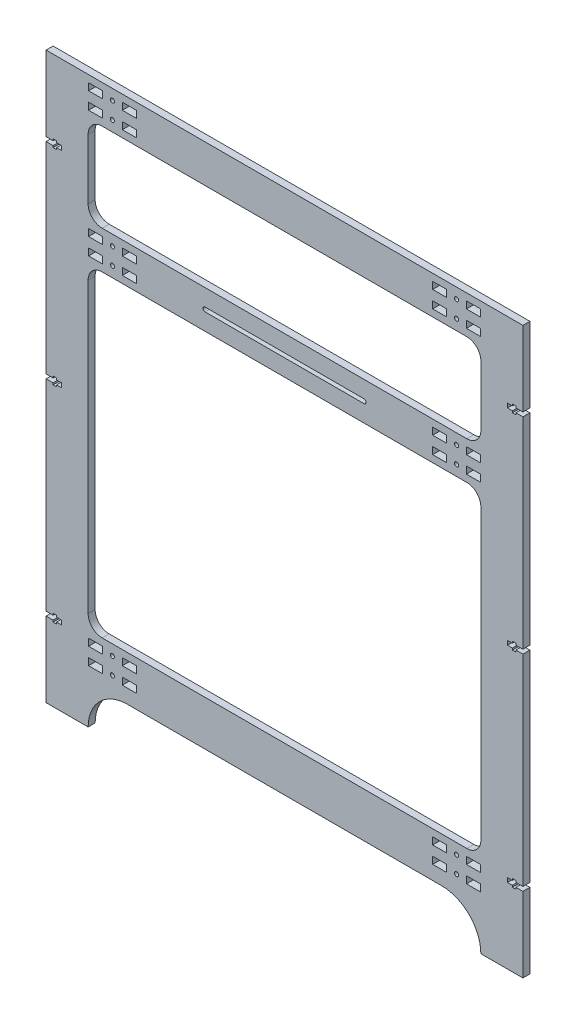
from build123d import *

# Parameters (mm, degrees)
SKETCH1_SIDE_SKETCH_2_W = 10
SKETCH1_SIDE_SKETCH_2_H = 5
SKETCH1_SIDE_SKETCH_2_R = 1.5
BOSS_EXTRUDE1_DEPTH     = 5


with BuildPart() as part:
    # Sketch1-Side Sketch<2> → Boss-Extrude1 (new body)
    with BuildSketch(Plane.XY):
        with BuildLine():
            Line((170, 100), (-170, 100))
            Line((-170, 100), (-170, 90))
            Line((-170, 90), (-170, 70))
            Line((-170, 70), (-170, 60))
            Line((-170, 60), (-170, 46.5))
            Line((-170, 46.5), (-165, 46.5))
            Line((-165, 46.5), (-165, 47.75))
            Line((-165, 47.75), (-162.5, 47.75))
            Line((-162.5, 47.75), (-162.5, 46.5))
            Line((-162.5, 46.5), (-159, 46.5))
            Line((-159, 46.5), (-159, 43.5))
            Line((-159, 43.5), (-162.5, 43.5))
            Line((-162.5, 43.5), (-162.5, 42.25))
            Line((-162.5, 42.25), (-165, 42.25))
            Line((-165, 42.25), (-165, 43.5))
            Line((-165, 43.5), (-170, 43.5))
            Line((-170, 43.5), (-170, 30))
            Line((-170, 30), (-170, 20))
            Line((-170, 20), (-170, -76.5))
            Line((-170, -76.5), (-170, -86.5))
            Line((-170, -86.5), (-170, -100))
            Line((-170, -100), (-165, -100))
            Line((-165, -100), (-165, -98.75))
            Line((-165, -98.75), (-162.5, -98.75))
            Line((-162.5, -98.75), (-162.5, -100))
            Line((-162.5, -100), (-159, -100))
            Line((-159, -100), (-159, -103))
            Line((-159, -103), (-162.5, -103))
            Line((-162.5, -103), (-162.5, -104.25))
            Line((-162.5, -104.25), (-165, -104.25))
            Line((-165, -104.25), (-165, -103))
            Line((-165, -103), (-170, -103))
            Line((-170, -103), (-170, -116.5))
            Line((-170, -116.5), (-170, -126.5))
            Line((-170, -126.5), (-170, -223))
            Line((-170, -223), (-170, -233))
            Line((-170, -233), (-170, -246.5))
            Line((-170, -246.5), (-165, -246.5))
            Line((-165, -246.5), (-165, -245.25))
            Line((-165, -245.25), (-162.5, -245.25))
            Line((-162.5, -245.25), (-162.5, -246.5))
            Line((-162.5, -246.5), (-159, -246.5))
            Line((-159, -246.5), (-159, -249.5))
            Line((-159, -249.5), (-162.5, -249.5))
            Line((-162.5, -249.5), (-162.5, -250.75))
            Line((-162.5, -250.75), (-165, -250.75))
            Line((-165, -250.75), (-165, -249.5))
            Line((-165, -249.5), (-170, -249.5))
            Line((-170, -249.5), (-170, -263))
            Line((-170, -263), (-170, -273))
            Line((-170, -273), (-170, -303))
            Line((-170, -303), (-140, -303))
            ThreePointArc((-140, -303), (-131.798989873, -283.201010127), (-112, -275))
            Line((-112, -275), (112, -275))
            ThreePointArc((112, -275), (131.798989873, -283.201010127), (140, -303))
            Line((140, -303), (170, -303))
            Line((170, -303), (170, -273))
            Line((170, -273), (170, -263))
            Line((170, -263), (170, -249.5))
            Line((170, -249.5), (165, -249.5))
            Line((165, -249.5), (165, -250.75))
            Line((165, -250.75), (162.5, -250.75))
            Line((162.5, -250.75), (162.5, -249.5))
            Line((162.5, -249.5), (159, -249.5))
            Line((159, -249.5), (159, -246.5))
            Line((159, -246.5), (162.5, -246.5))
            Line((162.5, -246.5), (162.5, -245.25))
            Line((162.5, -245.25), (165, -245.25))
            Line((165, -245.25), (165, -246.5))
            Line((165, -246.5), (170, -246.5))
            Line((170, -246.5), (170, -233))
            Line((170, -233), (170, -223))
            Line((170, -223), (170, -126.5))
            Line((170, -126.5), (170, -116.5))
            Line((170, -116.5), (170, -103))
            Line((170, -103), (165, -103))
            Line((165, -103), (165, -104.25))
            Line((165, -104.25), (162.5, -104.25))
            Line((162.5, -104.25), (162.5, -103))
            Line((162.5, -103), (159, -103))
            Line((159, -103), (159, -100))
            Line((159, -100), (162.5, -100))
            Line((162.5, -100), (162.5, -98.75))
            Line((162.5, -98.75), (165, -98.75))
            Line((165, -98.75), (165, -100))
            Line((165, -100), (170, -100))
            Line((170, -100), (170, -86.5))
            Line((170, -86.5), (170, -76.5))
            Line((170, -76.5), (170, 20))
            Line((170, 20), (170, 30))
            Line((170, 30), (170, 43.5))
            Line((170, 43.5), (165, 43.5))
            Line((165, 43.5), (165, 42.25))
            Line((165, 42.25), (162.5, 42.25))
            Line((162.5, 42.25), (162.5, 43.5))
            Line((162.5, 43.5), (159, 43.5))
            Line((159, 43.5), (159, 46.5))
            Line((159, 46.5), (162.5, 46.5))
            Line((162.5, 46.5), (162.5, 47.75))
            Line((162.5, 47.75), (165, 47.75))
            Line((165, 47.75), (165, 46.5))
            Line((165, 46.5), (170, 46.5))
            Line((170, 46.5), (170, 60))
            Line((170, 60), (170, 70))
            Line((170, 70), (170, 90))
            Line((170, 90), (170, 100))
        make_face()
        with Locations((-134.71277016, -262.5)):
            Rectangle(SKETCH1_SIDE_SKETCH_2_W, SKETCH1_SIDE_SKETCH_2_H, mode=Mode.SUBTRACT)
        with Locations((-122.683026536, -262.5)):
            Circle(SKETCH1_SIDE_SKETCH_2_R, mode=Mode.SUBTRACT)
        with Locations((-110.653282912, -262.5)):
            Rectangle(SKETCH1_SIDE_SKETCH_2_W, SKETCH1_SIDE_SKETCH_2_H, mode=Mode.SUBTRACT)
        with Locations((-134.71277016, -250.5)):
            Rectangle(SKETCH1_SIDE_SKETCH_2_W, SKETCH1_SIDE_SKETCH_2_H, mode=Mode.SUBTRACT)
        with Locations((-122.683026536, -250.5)):
            Circle(SKETCH1_SIDE_SKETCH_2_R, mode=Mode.SUBTRACT)
        with Locations((-110.653282912, -250.5)):
            Rectangle(SKETCH1_SIDE_SKETCH_2_W, SKETCH1_SIDE_SKETCH_2_H, mode=Mode.SUBTRACT)
        with Locations((110.653282912, -262.5)):
            Rectangle(SKETCH1_SIDE_SKETCH_2_W, SKETCH1_SIDE_SKETCH_2_H, mode=Mode.SUBTRACT)
        with Locations((122.683026536, -262.5)):
            Circle(SKETCH1_SIDE_SKETCH_2_R, mode=Mode.SUBTRACT)
        with Locations((134.71277016, -262.5)):
            Rectangle(SKETCH1_SIDE_SKETCH_2_W, SKETCH1_SIDE_SKETCH_2_H, mode=Mode.SUBTRACT)
        with Locations((110.653282912, -250.5)):
            Rectangle(SKETCH1_SIDE_SKETCH_2_W, SKETCH1_SIDE_SKETCH_2_H, mode=Mode.SUBTRACT)
        with Locations((122.683026536, -250.5)):
            Circle(SKETCH1_SIDE_SKETCH_2_R, mode=Mode.SUBTRACT)
        with Locations((134.71277016, -250.5)):
            Rectangle(SKETCH1_SIDE_SKETCH_2_W, SKETCH1_SIDE_SKETCH_2_H, mode=Mode.SUBTRACT)
        with BuildLine():
            Line((-130, -17), (130, -17))
            ThreePointArc((130, -17), (137.071067812, -19.928932188), (140, -27))
            Line((140, -27), (140, -233))
            ThreePointArc((140, -233), (137.071067812, -240.071067812), (130, -243))
            Line((130, -243), (-130, -243))
            ThreePointArc((-130, -243), (-137.071067812, -240.071067812), (-140, -233))
            Line((-140, -233), (-140, -27))
            ThreePointArc((-140, -27), (-137.071067812, -19.928932188), (-130, -17))
        make_face(mode=Mode.SUBTRACT)
        with Locations((-134.71277016, -9.5)):
            Rectangle(SKETCH1_SIDE_SKETCH_2_W, SKETCH1_SIDE_SKETCH_2_H, mode=Mode.SUBTRACT)
        with Locations((-122.683026536, -9.5)):
            Circle(SKETCH1_SIDE_SKETCH_2_R, mode=Mode.SUBTRACT)
        with Locations((-110.653282912, -9.5)):
            Rectangle(SKETCH1_SIDE_SKETCH_2_W, SKETCH1_SIDE_SKETCH_2_H, mode=Mode.SUBTRACT)
        with Locations((-134.71277016, 2.5)):
            Rectangle(SKETCH1_SIDE_SKETCH_2_W, SKETCH1_SIDE_SKETCH_2_H, mode=Mode.SUBTRACT)
        with Locations((-122.683026536, 2.5)):
            Circle(SKETCH1_SIDE_SKETCH_2_R, mode=Mode.SUBTRACT)
        with Locations((-110.653282912, 2.5)):
            Rectangle(SKETCH1_SIDE_SKETCH_2_W, SKETCH1_SIDE_SKETCH_2_H, mode=Mode.SUBTRACT)
        with Locations((-134.71277016, 80.5)):
            Rectangle(SKETCH1_SIDE_SKETCH_2_W, SKETCH1_SIDE_SKETCH_2_H, mode=Mode.SUBTRACT)
        with Locations((-122.683026536, 80.5)):
            Circle(SKETCH1_SIDE_SKETCH_2_R, mode=Mode.SUBTRACT)
        with Locations((-134.71277016, 92.5)):
            Rectangle(SKETCH1_SIDE_SKETCH_2_W, SKETCH1_SIDE_SKETCH_2_H, mode=Mode.SUBTRACT)
        with Locations((-122.683026536, 92.5)):
            Circle(SKETCH1_SIDE_SKETCH_2_R, mode=Mode.SUBTRACT)
        with Locations((-110.653282912, 80.5)):
            Rectangle(SKETCH1_SIDE_SKETCH_2_W, SKETCH1_SIDE_SKETCH_2_H, mode=Mode.SUBTRACT)
        with Locations((-110.653282912, 92.5)):
            Rectangle(SKETCH1_SIDE_SKETCH_2_W, SKETCH1_SIDE_SKETCH_2_H, mode=Mode.SUBTRACT)
        with BuildLine():
            Line((-130, 73), (130, 73))
            ThreePointArc((130, 73), (137.071067812, 70.071067812), (140, 63))
            Line((140, 63), (140, 20))
            ThreePointArc((140, 20), (137.071067812, 12.928932188), (130, 10))
            Line((130, 10), (-130, 10))
            ThreePointArc((-130, 10), (-137.071067812, 12.928932188), (-140, 20))
            Line((-140, 20), (-140, 63))
            ThreePointArc((-140, 63), (-137.071067812, 70.071067812), (-130, 73))
        make_face(mode=Mode.SUBTRACT)
        with BuildLine():
            ThreePointArc((-56.666666667, -5), (-58.166666667, -3.5), (-56.666666667, -2))
            Line((-56.666666667, -2), (56.666666667, -2))
            ThreePointArc((56.666666667, -2), (58.166666667, -3.5), (56.666666667, -5))
            Line((56.666666667, -5), (-56.666666667, -5))
        make_face(mode=Mode.SUBTRACT)
        with Locations((110.653282912, -9.5)):
            Rectangle(SKETCH1_SIDE_SKETCH_2_W, SKETCH1_SIDE_SKETCH_2_H, mode=Mode.SUBTRACT)
        with Locations((122.683026536, -9.5)):
            Circle(SKETCH1_SIDE_SKETCH_2_R, mode=Mode.SUBTRACT)
        with Locations((134.71277016, -9.5)):
            Rectangle(SKETCH1_SIDE_SKETCH_2_W, SKETCH1_SIDE_SKETCH_2_H, mode=Mode.SUBTRACT)
        with Locations((110.653282912, 2.5)):
            Rectangle(SKETCH1_SIDE_SKETCH_2_W, SKETCH1_SIDE_SKETCH_2_H, mode=Mode.SUBTRACT)
        with Locations((122.683026536, 2.5)):
            Circle(SKETCH1_SIDE_SKETCH_2_R, mode=Mode.SUBTRACT)
        with Locations((134.71277016, 2.5)):
            Rectangle(SKETCH1_SIDE_SKETCH_2_W, SKETCH1_SIDE_SKETCH_2_H, mode=Mode.SUBTRACT)
        with Locations((110.653282912, 80.5)):
            Rectangle(SKETCH1_SIDE_SKETCH_2_W, SKETCH1_SIDE_SKETCH_2_H, mode=Mode.SUBTRACT)
        with Locations((110.653282912, 92.5)):
            Rectangle(SKETCH1_SIDE_SKETCH_2_W, SKETCH1_SIDE_SKETCH_2_H, mode=Mode.SUBTRACT)
        with Locations((122.683026536, 80.5)):
            Circle(SKETCH1_SIDE_SKETCH_2_R, mode=Mode.SUBTRACT)
        with Locations((134.71277016, 80.5)):
            Rectangle(SKETCH1_SIDE_SKETCH_2_W, SKETCH1_SIDE_SKETCH_2_H, mode=Mode.SUBTRACT)
        with Locations((122.683026536, 92.5)):
            Circle(SKETCH1_SIDE_SKETCH_2_R, mode=Mode.SUBTRACT)
        with Locations((134.71277016, 92.5)):
            Rectangle(SKETCH1_SIDE_SKETCH_2_W, SKETCH1_SIDE_SKETCH_2_H, mode=Mode.SUBTRACT)
    extrude(amount=BOSS_EXTRUDE1_DEPTH)


solid = part.part
